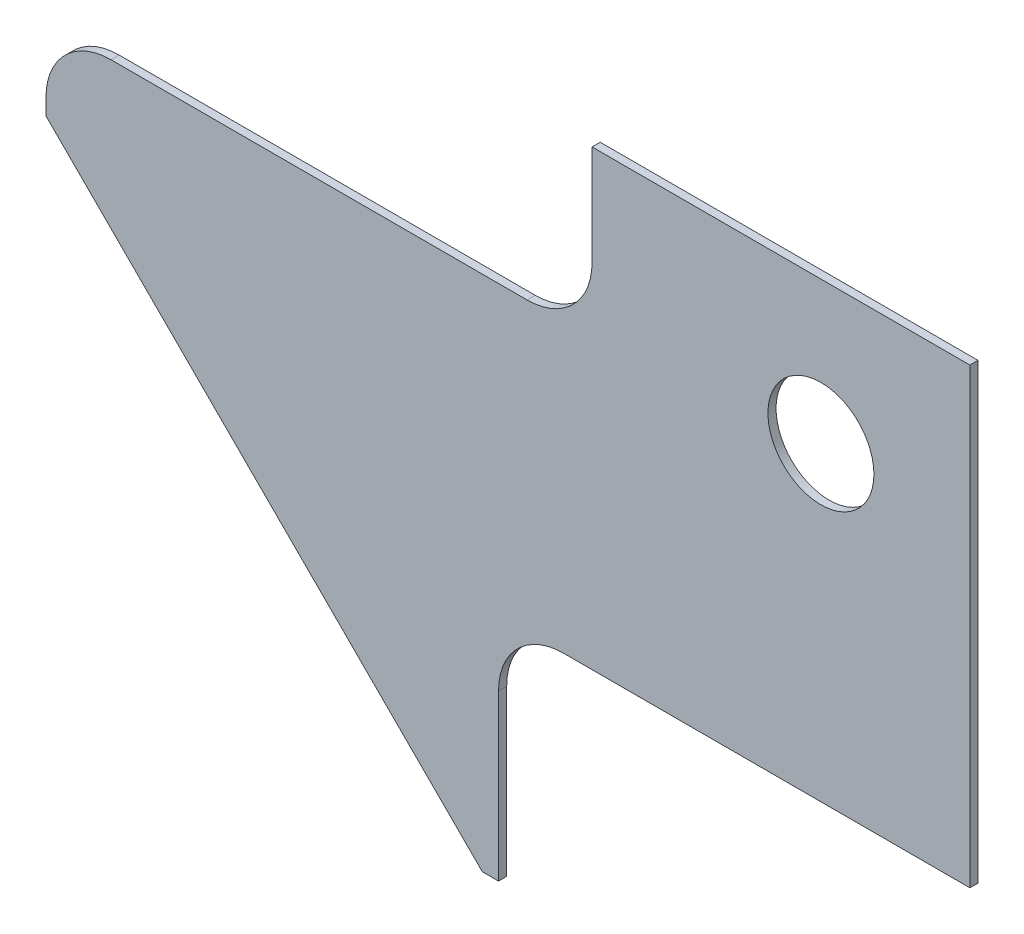
from build123d import *

# Parameters (mm, degrees)
SKETCH1_R           = 20.701
BOSS_EXTRUDE1_DEPTH = 3.175
SKETCH2_W           = 184.202806358
SKETCH2_H           = 89.807848405
CUT_EXTRUDE1_DEPTH  = 266.893552722
FILLET1_R           = 25.4
SKETCH4_W           = 213.36
SKETCH4_H           = 64.479988722
CUT_EXTRUDE2_DEPTH  = 266.893552722
FILLET2_R           = 25.4


with BuildPart() as part:
    # Sketch1 → Boss-Extrude1 (new body)
    with BuildSketch(Plane.XY):
        Polygon((-138.259383474, 48.991487021), (32.210627804, -121.478524257), (222.710627804, -121.478524257), (222.710627804, 145.221475743), (-138.259383474, 145.221475743), align=None)
        with Locations((164.515319313, 89.531975743)):
            Circle(SKETCH1_R, mode=Mode.SUBTRACT)
    extrude(amount=BOSS_EXTRUDE1_DEPTH)

    # Sketch2 → Cut-Extrude1 (cut, through all)
    with BuildSketch(Plane.XY.offset(3.175)):
        with Locations((130.662030983, -76.574600054)):
            Rectangle(SKETCH2_W, SKETCH2_H)
    extrude(amount=-CUT_EXTRUDE1_DEPTH, mode=Mode.SUBTRACT)

    # Fillet1
    fillet1_edges = [part.edges().sort_by_distance(p)[0] for p in [
        (38.560627804, -31.670675852, 1.5875),
    ]]
    fillet(fillet1_edges, radius=FILLET1_R)

    # Sketch4 → Cut-Extrude2 (cut, through all)
    with BuildSketch(Plane.XY.offset(3.175)):
        with Locations((-31.579383474, 112.981481382)):
            Rectangle(SKETCH4_W, SKETCH4_H)
    extrude(amount=-CUT_EXTRUDE2_DEPTH, mode=Mode.SUBTRACT)

    # Fillet2
    fillet2_edges = [part.edges().sort_by_distance(p)[0] for p in [
        (-138.259383474, 80.741487021, 1.5875),
        (75.100616526, 80.741487021, 1.5875),
    ]]
    fillet(fillet2_edges, radius=FILLET2_R)


solid = part.part
